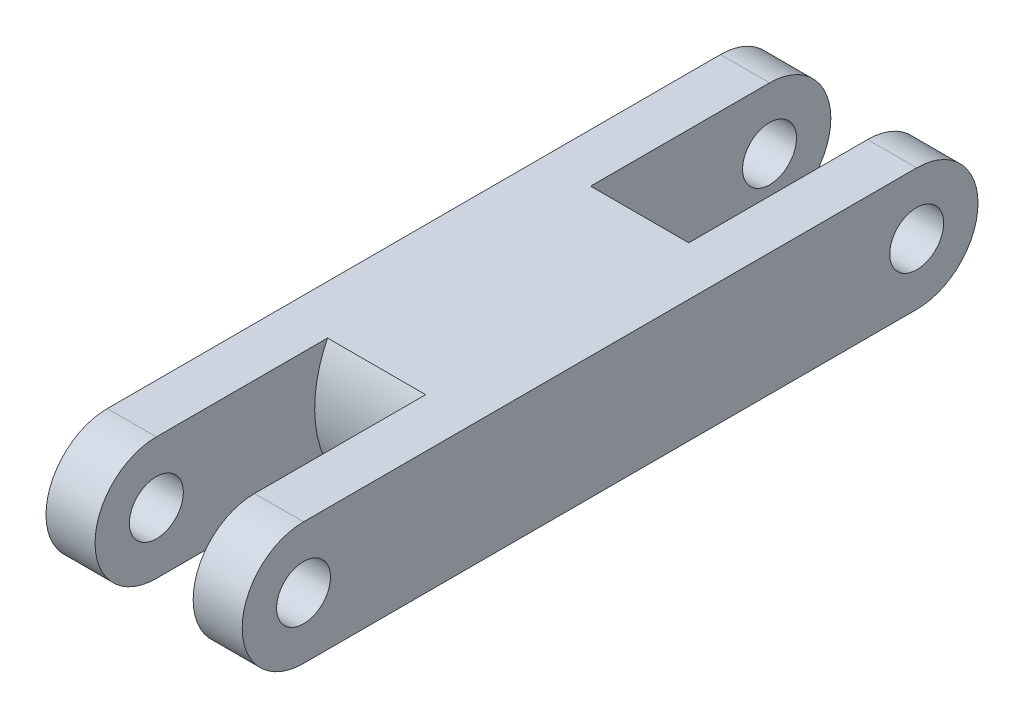
from build123d import *

# Parameters (mm, degrees)
SKETCH_1_R          = 1.1
EXTRUDE_1_DEPTH     = 4
SKETCH_2_R          = 4
CUT_EXTRUDE_1_DEPTH = 2
FILLET_1_R          = 5


with BuildPart() as part:
    # 草图1 → 凸台-拉伸1 (new, symmetric)
    with BuildSketch(Plane(origin=(0, 0, 0), x_dir=(0, 0, -1), z_dir=(1, 0, 0))):
        with BuildLine():
            Line((-12.5, 2.5), (12.5, 2.5))
            ThreePointArc((12.5, 2.5), (15, 0), (12.5, -2.5))
            Line((12.5, -2.5), (-12.5, -2.5))
            ThreePointArc((-12.5, -2.5), (-15, 0), (-12.5, 2.5))
        make_face()
        with Locations((12.5, 0)):
            Circle(SKETCH_1_R, mode=Mode.SUBTRACT)
        with Locations((-12.5, 0)):
            Circle(SKETCH_1_R, mode=Mode.SUBTRACT)
    extrude(amount=EXTRUDE_1_DEPTH, both=True)

    # 草图2 → 切除-拉伸1 (cut, symmetric)
    with BuildSketch(Plane(origin=(0, 0, 0), x_dir=(0, 0, -1), z_dir=(1, 0, 0))):
        with BuildLine():
            ThreePointArc((-9.377501001, 2.5), (-8.725745372, 1.324764885), (-8.5, 0))
            Line((-8.5, 0), (-5.520616019, 2.5))
            Line((-5.520616019, 2.5), (-9.377501001, 2.5))
        make_face()
        with BuildLine():
            Line((-5.520616019, -2.5), (-8.5, 0))
            ThreePointArc((-8.5, 0), (-8.725745372, -1.324764885), (-9.377501001, -2.5))
            Line((-9.377501001, -2.5), (-5.520616019, -2.5))
        make_face()
        with Locations((-12.5, 0)):
            Circle(SKETCH_2_R)
        with Locations((12.5, 0)):
            Circle(SKETCH_2_R)
        with BuildLine():
            Line((9.377501001, 2.5), (5.520616019, 2.5))
            Line((5.520616019, 2.5), (8.5, 0))
            ThreePointArc((8.5, 0), (8.725745372, 1.324764885), (9.377501001, 2.5))
        make_face()
        with BuildLine():
            ThreePointArc((9.377501001, -2.5), (8.725745372, -1.324764885), (8.5, 0))
            Line((8.5, 0), (5.520616019, -2.5))
            Line((5.520616019, -2.5), (9.377501001, -2.5))
        make_face()
    extrude(amount=CUT_EXTRUDE_1_DEPTH, both=True, mode=Mode.SUBTRACT)

    # 圆角1
    # the kernel refuses this fillet: 5 mm, written as the material it takes off along each edge
    with BuildSketch(Plane(origin=(2, 0, -8.5), x_dir=(0, -0.6427876096865346, 0.766044443118982), z_dir=(-1, 0, 0))) as fillet_1_piece_1:
        with BuildLine():
            CenterArc((5.885460651, 4.584253576), FILLET_1_R, 170, 76.469935568)
            Line((0.961421886, 5.452494464), (0, 0))
            Line((0, 0), (3.889309567, 0))
        make_face()
    extrude(amount=4, mode=Mode.SUBTRACT)
    with BuildSketch(Plane(origin=(-2, 0, 8.5), x_dir=(0, -0.6427876096865349, -0.7660444431189818), z_dir=(1, 0, 0))) as fillet_1_piece_2:
        with BuildLine():
            CenterArc((5.53660798, 5), FILLET_1_R, 193.530064432, 76.469935568)
            Line((0.675371519, 3.830222216), (0, 0))
            Line((0, 0), (5.53660798, 0))
        make_face()
    extrude(amount=4, mode=Mode.SUBTRACT)


solid = part.part
